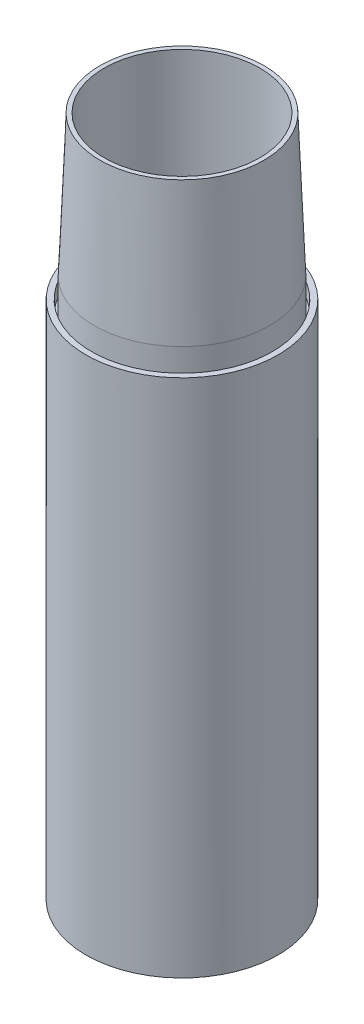
from build123d import *

# Parameters (mm, degrees)
FILLET1_R               = 2.5
CUT_EXTRUDE1_DEPTH      = 199.800520021
CUT_EXTRUDE1_DEPTH_BACK = 199.800520021
MOVE_FACE1_BY           = 1
MOVE_START              = -75
MOVE_FACE2_OUTLINE_R    = 27.3555
MOVE_FACE2_DEPTH        = 1


# Read off the part's stored shape, not the designer's step: Move Face2
with BuildPart() as part:
    # Sketch1 → Revolve1 (revolve)
    with BuildSketch(Plane.XY, mode=Mode.PRIVATE) as revolve1_sk:
        Polygon((-27.3555, 75), (-27.3555, -75), (-25.7555, -75), (-25.7555, -70), (-24.9555, -70), (-23.3555, -30), (-26.5555, -30), (-26.5555, 30), (-23.3555, 30), (-24.9555, 70), (-25.7555, 70), (-25.7555, 75), align=None)
    revolve(revolve1_sk.sketch.rotate(Axis((0, 0, 0), (0, 1, 0)), 270), axis=Axis((0, 0, 0), (0, 1, 0)))

    # Fillet1
    fillet1_edges = [part.edges().sort_by_distance(p)[0] for p in [
        (0, 30, 26.5555),
        (0, -30, 26.5555),
    ]]
    fillet(fillet1_edges, radius=FILLET1_R)

    # Sketch3 → Cut-Extrude1 (cut, two sides: drawn at the far end of the back side and taken through both)
    with BuildSketch(Plane(origin=(0, 120, 0), x_dir=(1, 0, 0), z_dir=(0, 1, 0)).offset(-CUT_EXTRUDE1_DEPTH_BACK)):
        Polygon((0, 26.9555), (-10, 0), (10, 0), align=None)
    extrude(amount=CUT_EXTRUDE1_DEPTH + CUT_EXTRUDE1_DEPTH_BACK, mode=Mode.SUBTRACT)

    # Move Face1: a face moved inward by 1.0
    extrude(part.faces().sort_by_distance((21.8844, 75, -13.67775))[0], amount=MOVE_FACE1_BY, dir=(0, -1, 0), mode=Mode.SUBTRACT)

    # Move Face2 outline → Move Face2 (cut)
    with BuildSketch(Plane(origin=(0, 0, 0), x_dir=(1, 0, 0), z_dir=(0, 1, 0)).offset(MOVE_START)):
        Circle(MOVE_FACE2_OUTLINE_R)
        with BuildLine():
            Line((0, 26.9555), (0.446614816, 25.751627433))
            ThreePointArc((0.446614816, 25.751627433), (0, -25.7555), (-0.446614816, 25.751627433))
            Line((-0.446614816, 25.751627433), (0, 26.9555))
        make_face(mode=Mode.SUBTRACT)
    extrude(amount=MOVE_FACE2_DEPTH, mode=Mode.SUBTRACT)


with BuildPart() as body_2:
    # Sketch2 → Revolve2 (revolve)
    with BuildSketch(Plane.XY, mode=Mode.PRIVATE) as revolve2_sk:
        Polygon((-24.9555, 70), (-24.9555, 80), (-23.3555, 120), (-22.1555, 120), (-22.1555, 30), (-23.3555, 30), align=None)
    revolve(revolve2_sk.sketch.rotate(Axis((0, 0, 0), (0, 1, 0)), 270), axis=Axis((0, 0, 0), (0, 1, 0)))


solid = Compound([part.part, body_2.part])
